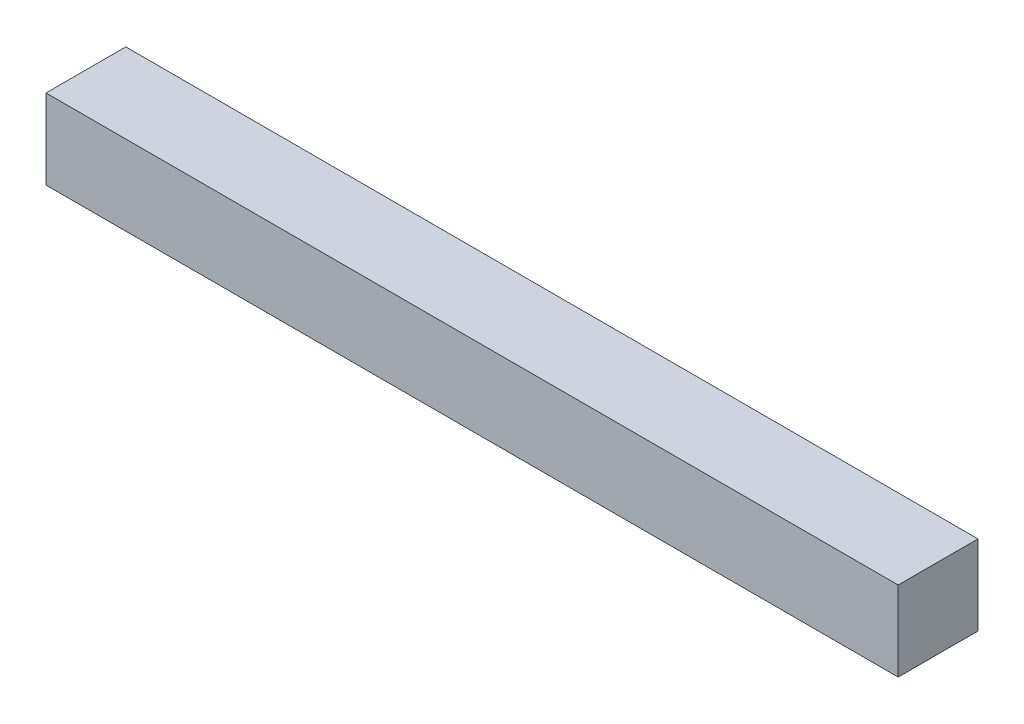
from build123d import *

# Parameters (mm, degrees)
SKETCH1_W           = 106.79
SKETCH1_H           = 10
BOSS_EXTRUDE1_DEPTH = 10


with BuildPart() as part:
    # Sketch1 → Boss-Extrude1 (new body)
    with BuildSketch(Plane.XY):
        with Locations((53.395, -5)):
            Rectangle(SKETCH1_W, SKETCH1_H)
    extrude(amount=BOSS_EXTRUDE1_DEPTH)


solid = part.part
